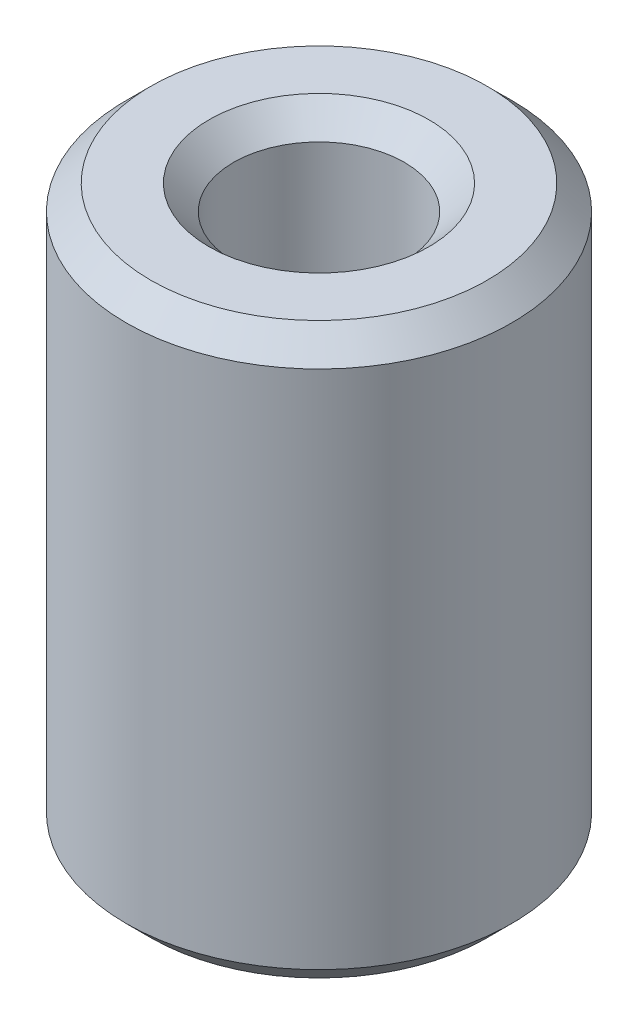
from build123d import *

# Parameters (mm, degrees)
SKETCH1_R           = 27.5
BOSS_EXTRUDE1_DEPTH = 81.230224646
SKETCH2_R           = 12.18641739
CUT_EXTRUDE1_DEPTH  = 91.060254252
CHAMFER1_SIZE       = 3.50983312


with BuildPart() as part:
    # Sketch1 → Boss-Extrude1 (new body)
    with BuildSketch(Plane(origin=(0, 0, 0), x_dir=(1, 0, 0), z_dir=(0, 1, 0))):
        Circle(SKETCH1_R)
    extrude(amount=BOSS_EXTRUDE1_DEPTH)

    # Sketch2 → Cut-Extrude1 (cut, through all)
    with BuildSketch(Plane(origin=(0, 0, 0), x_dir=(1, 0, 0), z_dir=(0, 1, 0))):
        Circle(SKETCH2_R)
    extrude(amount=CUT_EXTRUDE1_DEPTH, mode=Mode.SUBTRACT)

    # Chamfer1
    chamfer1_edges = [part.edges().sort_by_distance(p)[0] for p in [
        (-12.18641739, 81.230224646, 0),
        (-12.18641739, 0, 0),
        (-27.5, 0, 0),
        (-27.5, 81.230224646, 0),
    ]]
    chamfer(chamfer1_edges, length=CHAMFER1_SIZE)


solid = part.part
